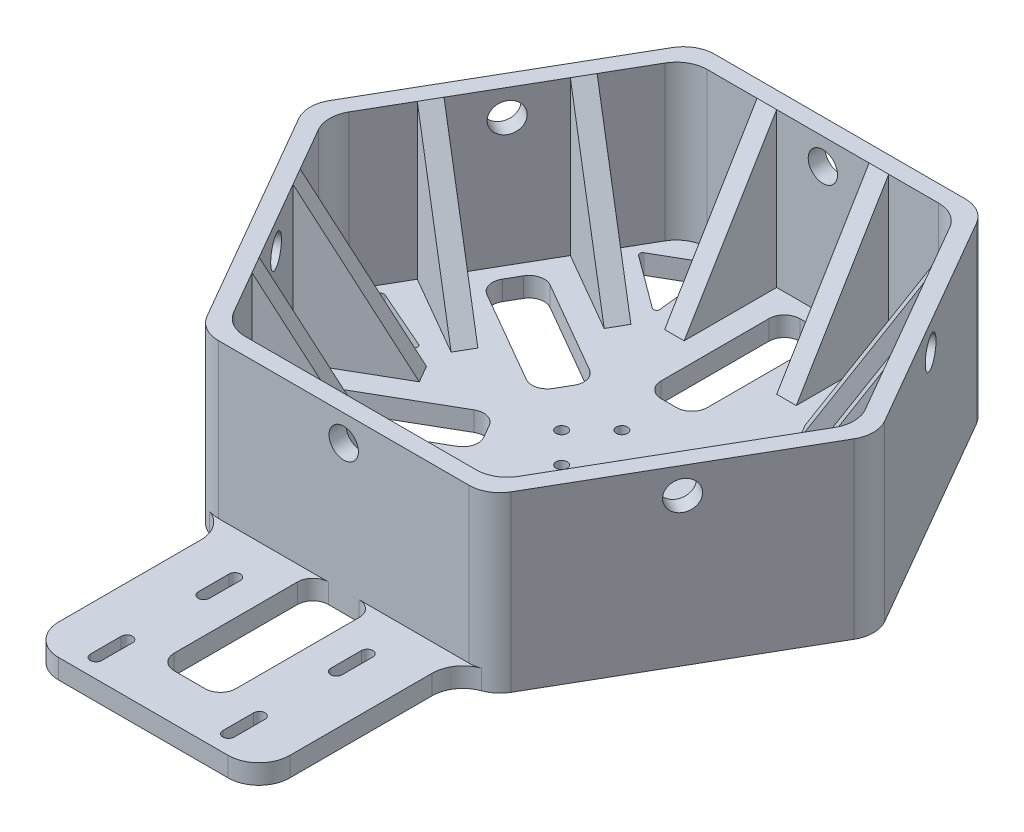
from build123d import *

# Parameters (mm, degrees)
BOSS_EXTRU_1_DEPTH                     = 50
BOSS_EXTRU_2_DEPTH                     = 6.35
NERVURE2_REACH                         = 148.047
ESQUISSE5_WALL_W                       = 352.403504036
ESQUISSE5_WALL_H                       = 6.35
R_P_TITION_CIRCULAIRE1_COUNT           = 6
R_P_TITION_CIRCULAIRE1_COPY_1_REACH    = 148.047
R_P_TITION_CIRCULAIRE1_COPY_1_SKETCH_W = 352.403504036
R_P_TITION_CIRCULAIRE1_COPY_1_SKETCH_H = 6.35
R_P_TITION_CIRCULAIRE1_COPY_2_REACH    = 148.047
R_P_TITION_CIRCULAIRE1_COPY_2_SKETCH_W = 352.403504036
R_P_TITION_CIRCULAIRE1_COPY_2_SKETCH_H = 6.35
R_P_TITION_CIRCULAIRE1_COPY_3_REACH    = 148.047
R_P_TITION_CIRCULAIRE1_COPY_3_SKETCH_W = 352.403504036
R_P_TITION_CIRCULAIRE1_COPY_3_SKETCH_H = 6.35
R_P_TITION_CIRCULAIRE1_COPY_4_REACH    = 148.047
R_P_TITION_CIRCULAIRE1_COPY_4_SKETCH_W = 352.403504036
R_P_TITION_CIRCULAIRE1_COPY_4_SKETCH_H = 6.35
R_P_TITION_CIRCULAIRE1_COPY_5_REACH    = 148.047
R_P_TITION_CIRCULAIRE1_COPY_5_SKETCH_W = 352.403504036
R_P_TITION_CIRCULAIRE1_COPY_5_SKETCH_H = 6.35
CONG_1_R                               = 10
ENL_V_MAT_EXTRU_1_REACH                = 193.764
ESQUISSE6_R                            = 4.7625
R_P_TITION_CIRCULAIRE2_COUNT           = 6
ESQUISSE7_W                            = 75
ESQUISSE7_H                            = 6.35
BOSS_EXTRU_3_DEPTH                     = 65
CONG_2_R                               = 10
ENL_V_MAT_EXTRU_2_DEPTH                = 68.65
R_P_TITION_LIN_AIRE1_COUNT             = 2
R_P_TITION_LIN_AIRE1_PITCH             = 35
SYM_TRIE2_COPY_1_DEPTH                 = 68.65
ENL_V_MAT_EXTRU_3_REACH                = 180.952
ESQUISSE10_R                           = 1.83
R_P_TITION_CIRCULAIRE3_COUNT           = 4
ENL_V_MAT_EXTRU_4_REACH                = 180.952
ESQUISSE11_W                           = 20
ESQUISSE11_H                           = 50
CONG_3_R                               = 5
ENL_V_MAT_EXTRU_5_REACH                = 180.952
ESQUISSE12_W                           = 15
ESQUISSE12_H                           = 45
CONG_4_R                               = 5
R_P_TITION_CIRCULAIRE4_COUNT           = 6
CONG_4_OF_R_P_TITION_CIRCULAIRE4_R     = 5
ENL_V_MAT_EXTRU_6_REACH                = 180.952
CONG_5_R                               = 1
R_P_TITION_CIRCULAIRE5_COUNT           = 6
CONG_5_OF_R_P_TITION_CIRCULAIRE5_R     = 1


with BuildPart() as part:
    # Esquisse1 → Boss.-Extru.1 (new body)
    with BuildSketch(Plane(origin=(0, 0, 0), x_dir=(1, 0, 0), z_dir=(0, 1, 0))):
        Polygon((46.475, -80.497061282), (92.95, 0), (46.475, 80.497061282), (-46.475, 80.497061282), (-92.95, 0), (-46.475, -80.497061282), align=None)
        Polygon((43.3, -74.997799968), (86.6, 0), (43.3, 74.997799968), (-43.3, 74.997799968), (-86.6, 0), (-43.3, -74.997799968), align=None, mode=Mode.SUBTRACT)
    extrude(amount=BOSS_EXTRU_1_DEPTH)

    # Esquisse2 → Boss.-Extru.2 (add)
    with BuildSketch(Plane.XZ):
        Polygon((46.475, 80.497061282), (92.95, 0), (46.475, -80.497061282), (-46.475, -80.497061282), (-92.95, 0), (-46.475, 80.497061282), align=None)
    extrude(amount=BOSS_EXTRU_2_DEPTH)

    # Esquisse5 wall → Nervure2 (add, up to next)
    with BuildSketch(Plane(origin=(18.18, 25, 59.997332475), x_dir=(0, -0.857485851479, -0.514507545633), z_dir=(0, 0.514507545633, -0.857485851479)), mode=Mode.PRIVATE) as nervure2_sk1:
        Rectangle(ESQUISSE5_WALL_W, ESQUISSE5_WALL_H)
    nervure2_tool1 = extrude(nervure2_sk1.sketch, amount=-NERVURE2_REACH, mode=Mode.PRIVATE) - part.part
    nervure2 = nervure2_tool1.solids().sort_by_distance((18.18, 25, 59.997332475))[0]
    add(nervure2)

    # Symétrie1: Nervure2 across plane
    add(nervure2.mirror(Plane(origin=(0, 0, 0), x_dir=(0, 0, 1), z_dir=(1, 0, 0))))

    # Répétition circulaire1: Nervure2 ×6 about axis
    r_p_tition_circulaire1_axis = Axis((0, 0, 0), (0, 1, 0))
    for i in range(1, R_P_TITION_CIRCULAIRE1_COUNT):
        add(nervure2.rotate(r_p_tition_circulaire1_axis, i * 360 / R_P_TITION_CIRCULAIRE1_COUNT))

    # Répétition circulaire1 copy 1 sketch → Répétition circulaire1 copy 1 (add, up to next)
    with BuildSketch(Plane(origin=(42.869214083, 25, 45.743008078), x_dir=(-0.44557660495695933, -0.857485851479, -0.2572537728165001), z_dir=(-0.7426045307665441, 0.514507545633, -0.4287429257395001)), mode=Mode.PRIVATE) as r_p_tition_circulaire1_copy_1_sk1:
        Rectangle(R_P_TITION_CIRCULAIRE1_COPY_1_SKETCH_W, R_P_TITION_CIRCULAIRE1_COPY_1_SKETCH_H)
    r_p_tition_circulaire1_copy_1_tool1 = extrude(r_p_tition_circulaire1_copy_1_sk1.sketch, amount=-R_P_TITION_CIRCULAIRE1_COPY_1_REACH, mode=Mode.PRIVATE) - part.part
    add(r_p_tition_circulaire1_copy_1_tool1.solids().sort_by_distance((42.869214083, 25, 45.743008078))[0])

    # Répétition circulaire1 copy 2 sketch → Répétition circulaire1 copy 2 (add, up to next)
    with BuildSketch(Plane(origin=(61.049214083, 25, -14.254324397), x_dir=(-0.4455766049569594, -0.857485851479, 0.2572537728164999), z_dir=(-0.7426045307665442, 0.514507545633, 0.42874292573949985)), mode=Mode.PRIVATE) as r_p_tition_circulaire1_copy_2_sk1:
        Rectangle(R_P_TITION_CIRCULAIRE1_COPY_2_SKETCH_W, R_P_TITION_CIRCULAIRE1_COPY_2_SKETCH_H)
    r_p_tition_circulaire1_copy_2_tool1 = extrude(r_p_tition_circulaire1_copy_2_sk1.sketch, amount=-R_P_TITION_CIRCULAIRE1_COPY_2_REACH, mode=Mode.PRIVATE) - part.part
    add(r_p_tition_circulaire1_copy_2_tool1.solids().sort_by_distance((61.049214083, 25, -14.254324397))[0])

    # Répétition circulaire1 copy 3 sketch → Répétition circulaire1 copy 3 (add, up to next)
    with BuildSketch(Plane(origin=(18.18, 25, -59.997332475), x_dir=(0, -0.857485851479, 0.514507545633), z_dir=(0, 0.514507545633, 0.857485851479)), mode=Mode.PRIVATE) as r_p_tition_circulaire1_copy_3_sk1:
        Rectangle(R_P_TITION_CIRCULAIRE1_COPY_3_SKETCH_W, R_P_TITION_CIRCULAIRE1_COPY_3_SKETCH_H)
    r_p_tition_circulaire1_copy_3_tool1 = extrude(r_p_tition_circulaire1_copy_3_sk1.sketch, amount=-R_P_TITION_CIRCULAIRE1_COPY_3_REACH, mode=Mode.PRIVATE) - part.part
    add(r_p_tition_circulaire1_copy_3_tool1.solids().sort_by_distance((18.18, 25, -59.997332475))[0])

    # Répétition circulaire1 copy 4 sketch → Répétition circulaire1 copy 4 (add, up to next)
    with BuildSketch(Plane(origin=(-42.869214083, 25, -45.743008078), x_dir=(0.4455766049569592, -0.857485851479, 0.25725377281650025), z_dir=(0.742604530766544, 0.514507545633, 0.4287429257395004)), mode=Mode.PRIVATE) as r_p_tition_circulaire1_copy_4_sk1:
        Rectangle(R_P_TITION_CIRCULAIRE1_COPY_4_SKETCH_W, R_P_TITION_CIRCULAIRE1_COPY_4_SKETCH_H)
    r_p_tition_circulaire1_copy_4_tool1 = extrude(r_p_tition_circulaire1_copy_4_sk1.sketch, amount=-R_P_TITION_CIRCULAIRE1_COPY_4_REACH, mode=Mode.PRIVATE) - part.part
    add(r_p_tition_circulaire1_copy_4_tool1.solids().sort_by_distance((-42.869214083, 25, -45.743008078))[0])

    # Répétition circulaire1 copy 5 sketch → Répétition circulaire1 copy 5 (add, up to next)
    with BuildSketch(Plane(origin=(-61.049214083, 25, 14.254324397), x_dir=(0.44557660495695933, -0.857485851479, -0.2572537728165001), z_dir=(0.7426045307665441, 0.514507545633, -0.4287429257395001)), mode=Mode.PRIVATE) as r_p_tition_circulaire1_copy_5_sk1:
        Rectangle(R_P_TITION_CIRCULAIRE1_COPY_5_SKETCH_W, R_P_TITION_CIRCULAIRE1_COPY_5_SKETCH_H)
    r_p_tition_circulaire1_copy_5_tool1 = extrude(r_p_tition_circulaire1_copy_5_sk1.sketch, amount=-R_P_TITION_CIRCULAIRE1_COPY_5_REACH, mode=Mode.PRIVATE) - part.part
    add(r_p_tition_circulaire1_copy_5_tool1.solids().sort_by_distance((-61.049214083, 25, 14.254324397))[0])

    # Congé1
    cong_1_edges = [part.edges().sort_by_distance(p)[0] for p in [
        (-46.475, 21.825, 80.497061282),
        (-92.95, 21.825, 0),
        (-46.475, 21.825, -80.497061282),
        (46.475, 21.825, -80.497061282),
        (92.95, 21.825, 0),
        (46.475, 21.825, 80.497061282),
        (-43.3, 25, 74.997799968),
        (43.3, 25, 74.997799968),
        (86.6, 25, 0),
        (43.3, 25, -74.997799968),
        (-43.3, 25, -74.997799968),
        (-86.6, 25, 0),
    ]]
    fillet(cong_1_edges, radius=CONG_1_R)

    # Esquisse6 → Enlèv. mat.-Extru.1 (cut, up to next)
    with BuildSketch(Plane.XY.offset(80.497061282), mode=Mode.PRIVATE) as enl_v_mat_extru_1_sk1:
        with Locations((0, 41.5)):
            Circle(ESQUISSE6_R)
    enl_v_mat_extru_1_tool1 = extrude(enl_v_mat_extru_1_sk1.sketch, amount=-ENL_V_MAT_EXTRU_1_REACH, mode=Mode.PRIVATE) & part.part
    enl_v_mat_extru_1 = enl_v_mat_extru_1_tool1.solids().sort_by_distance((0, 41.5, 80.497061))[0]
    add(enl_v_mat_extru_1, mode=Mode.SUBTRACT)

    # Répétition circulaire2: Enlèv. mat.-Extru.1 ×6 about axis
    r_p_tition_circulaire2_axis = Axis((0, 133.94385867, 0), (0, -1, 0))
    for i in range(1, R_P_TITION_CIRCULAIRE2_COUNT):
        add(enl_v_mat_extru_1.rotate(r_p_tition_circulaire2_axis, i * 360 / R_P_TITION_CIRCULAIRE2_COUNT), mode=Mode.SUBTRACT)

    # Esquisse7 → Boss.-Extru.3 (add)
    with BuildSketch(Plane.XY.offset(80.497061282)):
        with Locations((0, -3.175)):
            Rectangle(ESQUISSE7_W, ESQUISSE7_H)
    extrude(amount=BOSS_EXTRU_3_DEPTH)

    # Congé2
    # the kernel refuses this fillet: 10 mm, written as the material it adds along each edge
    with BuildSketch(Plane(origin=(-37.5, -6.35, 80.497061282), x_dir=(-0.9959554549812302, 0, -0.08984838169455728), z_dir=(0, 1, 0)), Plane(origin=(37.5, 0, 80.497061282), x_dir=(0.9959554549812301, 0, -0.0898483816945593), z_dir=(0, -1, 0))) as cong_2_piece_1:
        with BuildLine():
            CenterArc((9.168075665, 9.671905198), CONG_2_R, 185.154884664, 70.127687068)
            Line((-0.791478885, 8.773421381), (-1.78743434, 8.683572999))
            Line((-1.78743434, 8.683572999), (-0.995955455, -0.089848382))
            Line((-0.995955455, -0.089848382), (0.089848382, -0.995955455))
            ThreePointArc((0.089848382, -0.995955455), (3.27839709, -0.708306103), (6.373501938, -0.96719052))
            Line((6.373501938, -0.96719052), (6.627554095, 0))
        make_face()
    extrude(amount=6.35)
    # the kernel refuses this fillet: 10 mm, written as the material it takes off along each edge
    with BuildSketch(Plane(origin=(-37.5, -31.35, 145.497061282), x_dir=(0, 0, -1), z_dir=(0, 1, 0))) as cong_2_2_piece_1:
        with BuildLine():
            CenterArc((CONG_2_R, -CONG_2_R), CONG_2_R, 90, 90)
            Line((0, -CONG_2_R), (0, 0))
            Line((0, 0), (CONG_2_R, 0))
        make_face()
    extrude(amount=56.35, mode=Mode.SUBTRACT)
    with BuildSketch(Plane(origin=(37.5, 25, 145.497061282), x_dir=(-1, 0, 0), z_dir=(0, -1, 0))) as cong_2_2_piece_2:
        with BuildLine():
            CenterArc((CONG_2_R, CONG_2_R), CONG_2_R, 180, 90)
            Line((0, CONG_2_R), (0, 0))
            Line((0, 0), (CONG_2_R, 0))
        make_face()
    extrude(amount=56.35, mode=Mode.SUBTRACT)

    # Esquisse9 → Enlèv. mat.-Extru.2 (cut)
    with BuildSketch(Plane(origin=(0, 0, 0), x_dir=(1, 0, 0), z_dir=(0, 1, 0))):
        with BuildLine():
            Line((-23.335, -94.377061282), (-23.335, -104.377061282))
            ThreePointArc((-23.335, -104.377061282), (-21.5, -106.212061282), (-19.665, -104.377061282))
            Line((-19.665, -104.377061282), (-19.665, -94.377061282))
            ThreePointArc((-19.665, -94.377061282), (-21.5, -92.542061282), (-23.335, -94.377061282))
        make_face()
    enl_v_mat_extru_2 = extrude(amount=-ENL_V_MAT_EXTRU_2_DEPTH, mode=Mode.SUBTRACT)

    # Répétition linéaire1: Enlèv. mat.-Extru.2 ×2
    with Locations(*[(0, 0, i * R_P_TITION_LIN_AIRE1_PITCH) for i in range(1, R_P_TITION_LIN_AIRE1_COUNT)]):
        add(enl_v_mat_extru_2, mode=Mode.SUBTRACT)

    # Symétrie2: Enlèv. mat.-Extru.2 across plane
    add(enl_v_mat_extru_2.mirror(Plane(origin=(0, 0, 0), x_dir=(0, 0, 1), z_dir=(1, 0, 0))), mode=Mode.SUBTRACT)

    # Symétrie2 copy 1 sketch → Symétrie2 copy 1 (cut)
    with BuildSketch(Plane(origin=(0, 0, 35), x_dir=(-1, 0, 0), z_dir=(0, 1, 0))):
        with BuildLine():
            Line((-23.335, 94.377061282), (-23.335, 104.377061282))
            ThreePointArc((-23.335, 104.377061282), (-21.5, 106.212061282), (-19.665, 104.377061282))
            Line((-19.665, 104.377061282), (-19.665, 94.377061282))
            ThreePointArc((-19.665, 94.377061282), (-21.5, 92.542061282), (-23.335, 94.377061282))
        make_face()
    extrude(amount=-SYM_TRIE2_COPY_1_DEPTH, mode=Mode.SUBTRACT)

    # Esquisse10 → Enlèv. mat.-Extru.3 (cut, up to next)
    with BuildSketch(Plane(origin=(0, 0, 0), x_dir=(1, 0, 0), z_dir=(0, 1, 0)), mode=Mode.PRIVATE) as enl_v_mat_extru_3_sk1:
        with Locations(Location((0, 9.78, 0), (0, 0, 270))):
            Circle(ESQUISSE10_R)
    enl_v_mat_extru_3_tool1 = extrude(enl_v_mat_extru_3_sk1.sketch, amount=-ENL_V_MAT_EXTRU_3_REACH, mode=Mode.PRIVATE) & part.part
    enl_v_mat_extru_3 = enl_v_mat_extru_3_tool1.solids().sort_by_distance((0, 0, -9.78))[0]
    add(enl_v_mat_extru_3, mode=Mode.SUBTRACT)

    # Répétition circulaire3: Enlèv. mat.-Extru.3 ×4 about axis
    r_p_tition_circulaire3_axis = Axis((0, 0, 0), (0, 1, 0))
    for i in range(1, R_P_TITION_CIRCULAIRE3_COUNT):
        add(enl_v_mat_extru_3.rotate(r_p_tition_circulaire3_axis, i * 360 / R_P_TITION_CIRCULAIRE3_COUNT), mode=Mode.SUBTRACT)

    # Esquisse11 → Enlèv. mat.-Extru.4 (cut, up to next)
    with BuildSketch(Plane(origin=(0, 0, 0), x_dir=(1, 0, 0), z_dir=(0, 1, 0)), mode=Mode.PRIVATE) as enl_v_mat_extru_4_sk1:
        with Locations((0, -105.497061282)):
            Rectangle(ESQUISSE11_W, ESQUISSE11_H)
    enl_v_mat_extru_4_tool1 = extrude(enl_v_mat_extru_4_sk1.sketch, amount=-ENL_V_MAT_EXTRU_4_REACH, mode=Mode.PRIVATE) & part.part
    add(enl_v_mat_extru_4_tool1.solids().sort_by_distance((0, 0, 105.497061))[0], mode=Mode.SUBTRACT)

    # Congé3
    cong_3_edges = [part.edges().sort_by_distance(p)[0] for p in [
        (-10, -3.175, 80.497061282),
        (10, -3.175, 80.497061282),
        (10, -3.175, 130.497061282),
        (-10, -3.175, 130.497061282),
    ]]
    fillet(cong_3_edges, radius=CONG_3_R)

    # Esquisse12 → Enlèv. mat.-Extru.5 (cut, up to next)
    with BuildSketch(Plane(origin=(0, 0, 0), x_dir=(1, 0, 0), z_dir=(0, 1, 0)), mode=Mode.PRIVATE) as enl_v_mat_extru_5_sk1:
        with Locations((0, -47.5)):
            Rectangle(ESQUISSE12_W, ESQUISSE12_H)
    enl_v_mat_extru_5_tool1 = extrude(enl_v_mat_extru_5_sk1.sketch, amount=-ENL_V_MAT_EXTRU_5_REACH, mode=Mode.PRIVATE) & part.part
    enl_v_mat_extru_5 = enl_v_mat_extru_5_tool1.solids().sort_by_distance((0, 0, 47.5))[0]
    add(enl_v_mat_extru_5, mode=Mode.SUBTRACT)

    # Congé4
    cong_4_edges = [part.edges().sort_by_distance(p)[0] for p in [
        (-7.5, -3.175, 70),
        (-7.5, -3.175, 25),
        (7.5, -3.175, 25),
        (7.5, -3.175, 70),
    ]]
    fillet(cong_4_edges, radius=CONG_4_R)

    # Répétition circulaire4: Enlèv. mat.-Extru.5 ×6 about axis
    r_p_tition_circulaire4_axis = Axis((0, 0, 0), (0, 1, 0))
    for i in range(1, R_P_TITION_CIRCULAIRE4_COUNT):
        add(enl_v_mat_extru_5.rotate(r_p_tition_circulaire4_axis, i * 360 / R_P_TITION_CIRCULAIRE4_COUNT), mode=Mode.SUBTRACT)

    # Congé4 of Répétition circulaire4
    cong_4_of_r_p_tition_circulaire4_edges = [part.edges().sort_by_distance(p)[0] for p in [
        (56.871778265, -3.175, 41.495190528),
        (17.900635095, -3.175, 18.995190528),
        (25.400635095, -3.175, 6.004809472),
        (64.371778265, -3.175, 28.504809472),
        (64.371778265, -3.175, -28.504809472),
        (25.400635095, -3.175, -6.004809472),
        (17.900635095, -3.175, -18.995190528),
        (56.871778265, -3.175, -41.495190528),
        (7.5, -3.175, -70),
        (7.5, -3.175, -25),
        (-7.5, -3.175, -25),
        (-7.5, -3.175, -70),
        (-56.871778265, -3.175, -41.495190528),
        (-17.900635095, -3.175, -18.995190528),
        (-25.400635095, -3.175, -6.004809472),
        (-64.371778265, -3.175, -28.504809472),
        (-64.371778265, -3.175, 28.504809472),
        (-25.400635095, -3.175, 6.004809472),
        (-17.900635095, -3.175, 18.995190528),
        (-56.871778265, -3.175, 41.495190528),
    ]]
    fillet(cong_4_of_r_p_tition_circulaire4_edges, radius=CONG_4_OF_R_P_TITION_CIRCULAIRE4_R)

    # Esquisse13 → Enlèv. mat.-Extru.6 (cut, up to next)
    with BuildSketch(Plane(origin=(0, 0, 0), x_dir=(1, 0, 0), z_dir=(0, 1, 0)), mode=Mode.PRIVATE) as enl_v_mat_extru_6_sk1:
        Polygon((55, 0), (77.912878475, -10), (77.912878475, 10), align=None)
    enl_v_mat_extru_6_tool1 = extrude(enl_v_mat_extru_6_sk1.sketch, amount=-ENL_V_MAT_EXTRU_6_REACH, mode=Mode.PRIVATE) & part.part
    enl_v_mat_extru_6 = enl_v_mat_extru_6_tool1.solids().sort_by_distance((70.275252, 0, 0))[0]
    add(enl_v_mat_extru_6, mode=Mode.SUBTRACT)

    # Congé5
    cong_5_edges = [part.edges().sort_by_distance(p)[0] for p in [
        (55, -3.175, 0),
        (77.912878475, -3.175, -10),
        (77.912878475, -3.175, 10),
    ]]
    fillet(cong_5_edges, radius=CONG_5_R)

    # Répétition circulaire5: Enlèv. mat.-Extru.6 ×6 about axis
    r_p_tition_circulaire5_axis = Axis((0, 0, 0), (0, 1, 0))
    for i in range(1, R_P_TITION_CIRCULAIRE5_COUNT):
        add(enl_v_mat_extru_6.rotate(r_p_tition_circulaire5_axis, i * 360 / R_P_TITION_CIRCULAIRE5_COUNT), mode=Mode.SUBTRACT)

    # Congé5 of Répétition circulaire5
    cong_5_of_r_p_tition_circulaire5_edges = [part.edges().sort_by_distance(p)[0] for p in [
        (27.5, -3.175, -47.631397208),
        (30.2961852, -3.175, -72.474532041),
        (47.616693275, -3.175, -62.474532041),
        (-27.5, -3.175, -47.631397208),
        (-47.616693275, -3.175, -62.474532041),
        (-30.2961852, -3.175, -72.474532041),
        (-55, -3.175, 0),
        (-77.912878475, -3.175, 10),
        (-77.912878475, -3.175, -10),
        (-27.5, -3.175, 47.631397208),
        (-30.2961852, -3.175, 72.474532041),
        (-47.616693275, -3.175, 62.474532041),
        (27.5, -3.175, 47.631397208),
        (47.616693275, -3.175, 62.474532041),
        (30.2961852, -3.175, 72.474532041),
    ]]
    fillet(cong_5_of_r_p_tition_circulaire5_edges, radius=CONG_5_OF_R_P_TITION_CIRCULAIRE5_R)


solid = part.part
